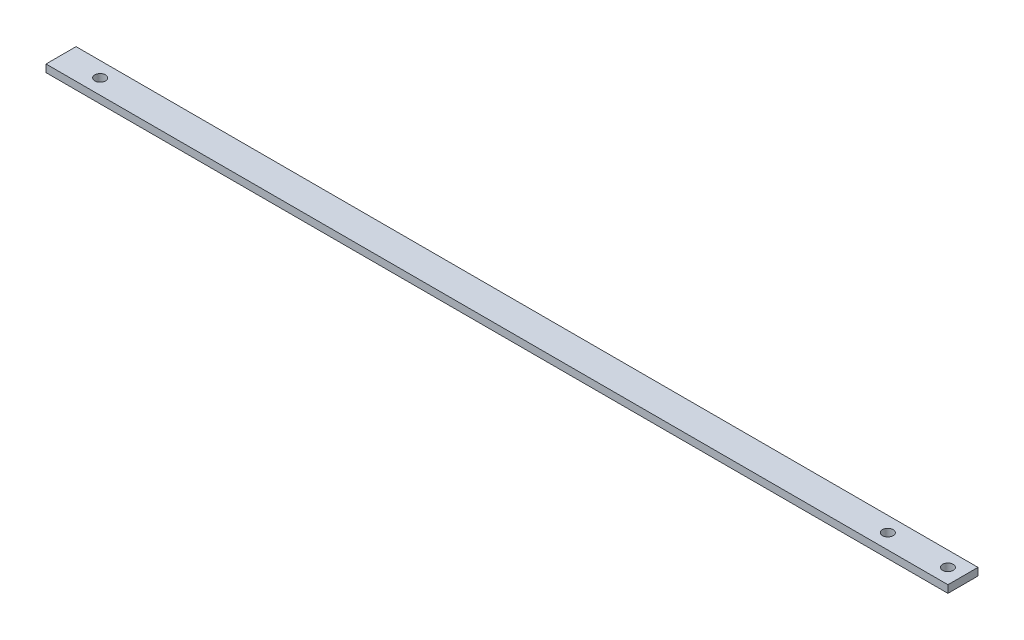
from build123d import *

# Parameters (mm, degrees)
SKETCH1_R           = 2.2479
BOSS_EXTRUDE2_DEPTH = 3.175


with BuildPart() as part:
    # Sketch1 → Boss-Extrude2 (new body)
    with BuildSketch(Plane(origin=(0, 0, 0), x_dir=(1, 0, 0), z_dir=(0, 1, 0))):
        Polygon((0, 12.7), (0, 6.35), (0, 0), (381, 0), (381, 12.7), align=None)
        with Locations((349.25, 6.35)):
            Circle(SKETCH1_R, mode=Mode.SUBTRACT)
        with BuildLine():
            ThreePointArc((18.7833, 6.35), (16.5354, 4.1021), (14.2875, 6.35))
            ThreePointArc((14.2875, 6.35), (16.5354, 8.5979), (18.7833, 6.35))
        make_face(mode=Mode.SUBTRACT)
        with Locations((374.65, 6.35)):
            Circle(SKETCH1_R, mode=Mode.SUBTRACT)
    extrude(amount=BOSS_EXTRUDE2_DEPTH)


solid = part.part
